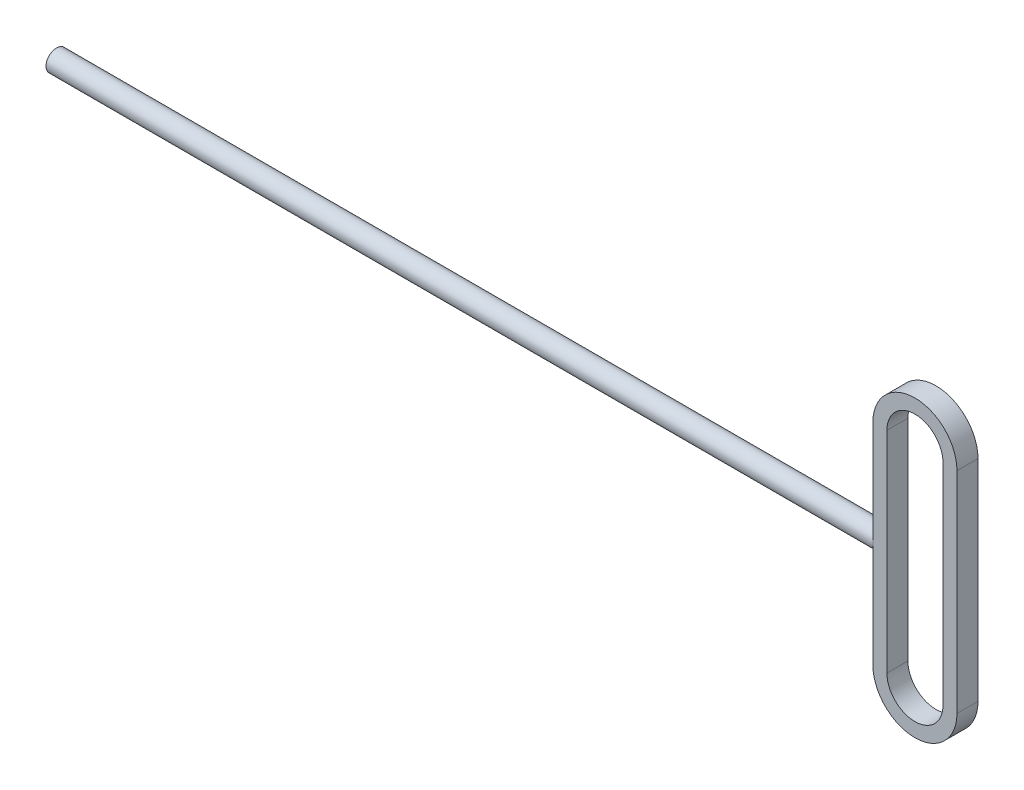
from build123d import *

# Parameters (mm, degrees)
EXTRUDE_1_DEPTH     = 3
EXTRUDE_START       = -120
EXTRUDE_2_OUTLINE_R = 1.5
EXTRUDE_2_DEPTH     = 118


# Read off the part's stored shape, not the designer's step: 凸台-拉伸2
with BuildPart() as part:
    # 草图1 → 凸台-拉伸1 (new body)
    with BuildSketch(Plane.XY):
        with BuildLine():
            Line((10, -29.761156884), (10, -59.761156884))
            ThreePointArc((10, -59.761156884), (4, -65.761156884), (-2, -59.761156884))
            Line((-2, -59.761156884), (-2, -29.761156884))
            ThreePointArc((-2, -29.761156884), (4, -23.761156884), (10, -29.761156884))
        make_face()
        with BuildLine():
            Line((0, -29.761156884), (0, -59.761156884))
            ThreePointArc((0, -59.761156884), (4, -63.761156884), (8, -59.761156884))
            Line((8, -59.761156884), (8, -29.761156884))
            ThreePointArc((8, -29.761156884), (4, -25.761156884), (0, -29.761156884))
        make_face(mode=Mode.SUBTRACT)
    extrude(amount=EXTRUDE_1_DEPTH)

    # 凸台-拉伸2 outline → 凸台-拉伸2 (add)
    with BuildSketch(Plane.YZ.offset(EXTRUDE_START)):
        with Locations((-44.761156884, 1.5)):
            Circle(EXTRUDE_2_OUTLINE_R)
    extrude(amount=EXTRUDE_2_DEPTH)


solid = part.part
